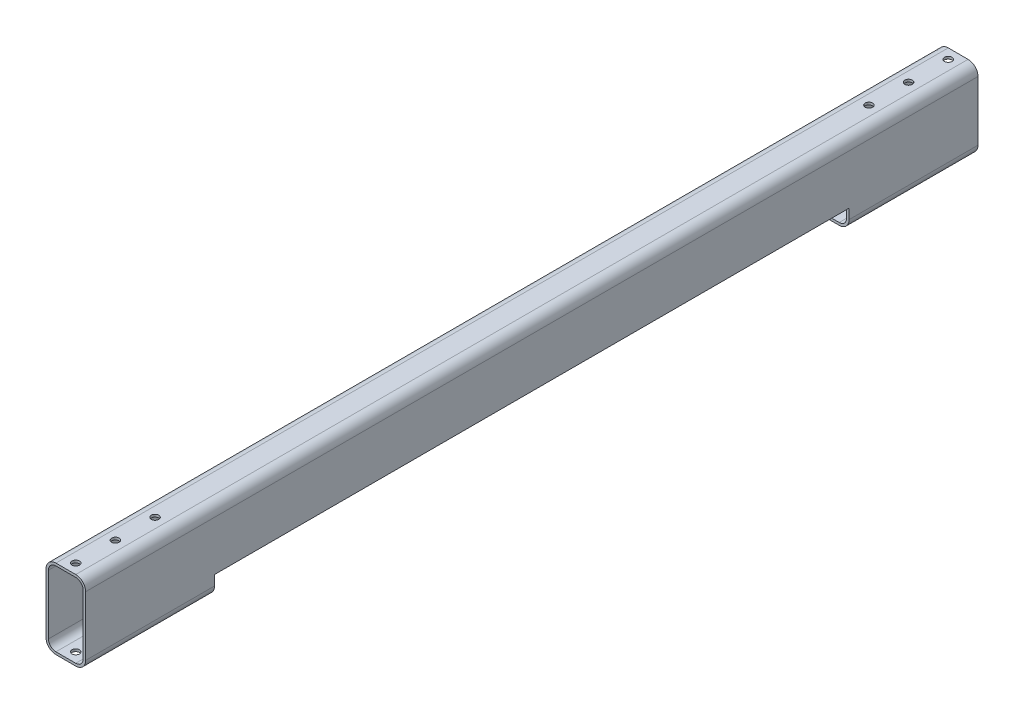
from build123d import *

# Parameters (mm, degrees)
EXTRUDE_THIN1_DEPTH            = 571.5
F_3_16_0_1875_DIAMETER_HOLE1_D = 4.7625
SKETCH5_W                      = 406.4
SKETCH5_H                      = 12.7
CUT_EXTRUDE1_DEPTH             = 573.627776134


with BuildPart() as part:
    # Sketch1 → Extrude-Thin1 (new body)
    with BuildSketch(Plane.XY):
        with BuildLine():
            Line((-12.7, 19.05), (-12.7, -19.05))
            ThreePointArc((-12.7, -19.05), (-10.840128061, -23.540128061), (-6.35, -25.4))
            Line((-6.35, -25.4), (6.35, -25.4))
            ThreePointArc((6.35, -25.4), (10.840128061, -23.540128061), (12.7, -19.05))
            Line((12.7, -19.05), (12.7, 19.05))
            ThreePointArc((12.7, 19.05), (10.840128061, 23.540128061), (6.35, 25.4))
            Line((6.35, 25.4), (-6.35, 25.4))
            ThreePointArc((-6.35, 25.4), (-10.840128061, 23.540128061), (-12.7, 19.05))
        make_face()
        with BuildLine():
            Line((-11.1125, 19.05), (-11.1125, -19.05))
            ThreePointArc((-11.1125, -19.05), (-9.717596045, -22.417596045), (-6.35, -23.8125))
            Line((-6.35, -23.8125), (6.35, -23.8125))
            ThreePointArc((6.35, -23.8125), (9.717596045, -22.417596045), (11.1125, -19.05))
            Line((11.1125, -19.05), (11.1125, 19.05))
            ThreePointArc((11.1125, 19.05), (9.717596045, 22.417596045), (6.35, 23.8125))
            Line((6.35, 23.8125), (-6.35, 23.8125))
            ThreePointArc((-6.35, 23.8125), (-9.717596045, 22.417596045), (-11.1125, 19.05))
        make_face(mode=Mode.SUBTRACT)
    extrude(amount=EXTRUDE_THIN1_DEPTH)

    # 3/16 (0.1875) Diameter Hole1 (through all)
    with Locations(Plane(origin=(0, 25.4, 565.15), x_dir=(0, 0, 1), z_dir=(0, 1, 0))):
        with Locations((0, 0), (-558.8, 0), (-533.4, 0), (-508, 0), (-25.4, 0), (-50.8, 0)):
            Hole(F_3_16_0_1875_DIAMETER_HOLE1_D / 2)

    # Sketch5 → Cut-Extrude1 (cut, through all)
    with BuildSketch(Plane(origin=(12.7, 0, 0), x_dir=(0, 0, -1), z_dir=(1, 0, 0))):
        with Locations((-285.75, -19.05)):
            Rectangle(SKETCH5_W, SKETCH5_H)
    extrude(amount=-CUT_EXTRUDE1_DEPTH, mode=Mode.SUBTRACT)


solid = part.part
